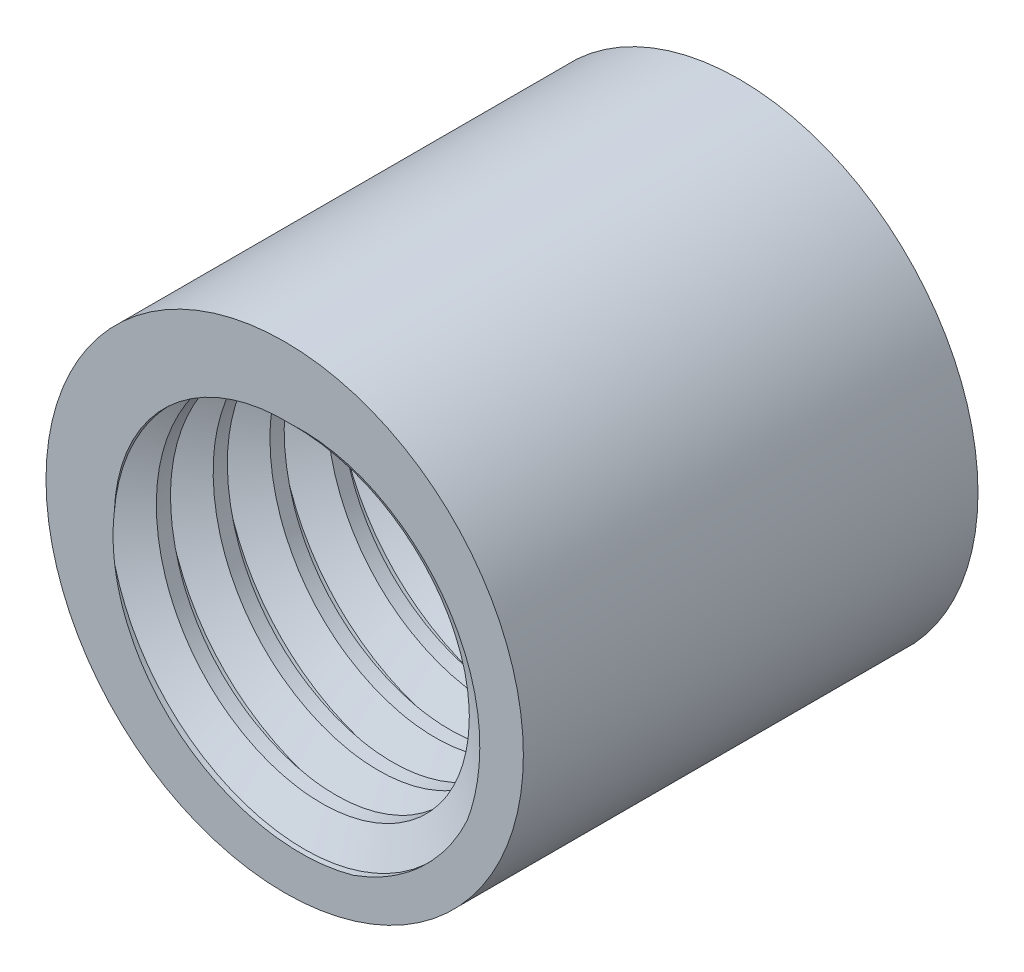
from build123d import *

# Parameters (mm, degrees)
SKETCH1_R           = 2.1
SKETCH1_R_2         = 1.5
BOSS_EXTRUDE1_DEPTH = 4
THREAD1_PITCH       = 0.5


with BuildPart() as part:
    # Sketch1 → Boss-Extrude1 (new body)
    with BuildSketch(Plane.XY):
        Circle(SKETCH1_R)
        Circle(SKETCH1_R_2, mode=Mode.SUBTRACT)
    extrude(amount=BOSS_EXTRUDE1_DEPTH)

    # Thread1: the profile of Thread Profile1 profile screwed along a right-hand helix of 20 turns, 6 arcs to a turn; built about Z, then put on its axis
    thread1_z = Axis((0, 0, 0), (0, 0, 1))
    thread1_corners = [(1.4997, 0, -0.000173205), (1.770632938, -1e-09, 0.156249999), (1.770632938, -1e-09, 0.218749999), (1.4997, 0, 0.375173204)]
    with BuildLine(mode=Mode.PRIVATE) as thread1_profile:
        Line(thread1_corners[0], thread1_corners[1])
        Line(thread1_corners[1], thread1_corners[2])
        Line(thread1_corners[2], thread1_corners[3])
        Line(thread1_corners[3], thread1_corners[0])
    thread1_cap = Face(thread1_profile.wire())
    thread1_turn_angles = [0, 30, 60, 90, 120, 150, 180, 210, 240, 270, 300, 330, 360]
    thread1_turn_weights = [1, 0.8660254037844387, 1, 0.8660254037844387, 1, 0.8660254037844387, 1, 0.8660254037844387, 1, 0.8660254037844387, 1, 0.8660254037844387, 1]
    thread1_turn_rails = [Edge.make_bspline([Vector(p[0], p[1], 0).rotate(thread1_z, thread1_turn_angles[k]) / thread1_turn_weights[k] + Vector(0, 0, p[2] + THREAD1_PITCH * thread1_turn_angles[k] / 360) for k in range(13)], [0, 0, 0, 1, 1, 2, 2, 3, 3, 4, 4, 5, 5, 6, 6, 6], 2, thread1_turn_weights) for p in thread1_corners]
    thread1_turn_sides = [Face.make_surface_from_curves(thread1_turn_rails[p[0]], thread1_turn_rails[p[1]]) for p in [(0, 1), (1, 2), (2, 3), (3, 0)]]
    thread1 = Plane(origin=(0, 0, 5), x_dir=(-0.999390827, 0.034899497, 0), z_dir=(0, 0, -1)) * Solid(Shell([*[p.moved(Location((0, 0, THREAD1_PITCH * i))) for i in range(20) for p in thread1_turn_sides], thread1_cap, thread1_cap.rotate(thread1_z, 7200).moved(Location((0, 0, THREAD1_PITCH * 7200 / 360)))]))
    add(thread1, mode=Mode.SUBTRACT)


solid = part.part
